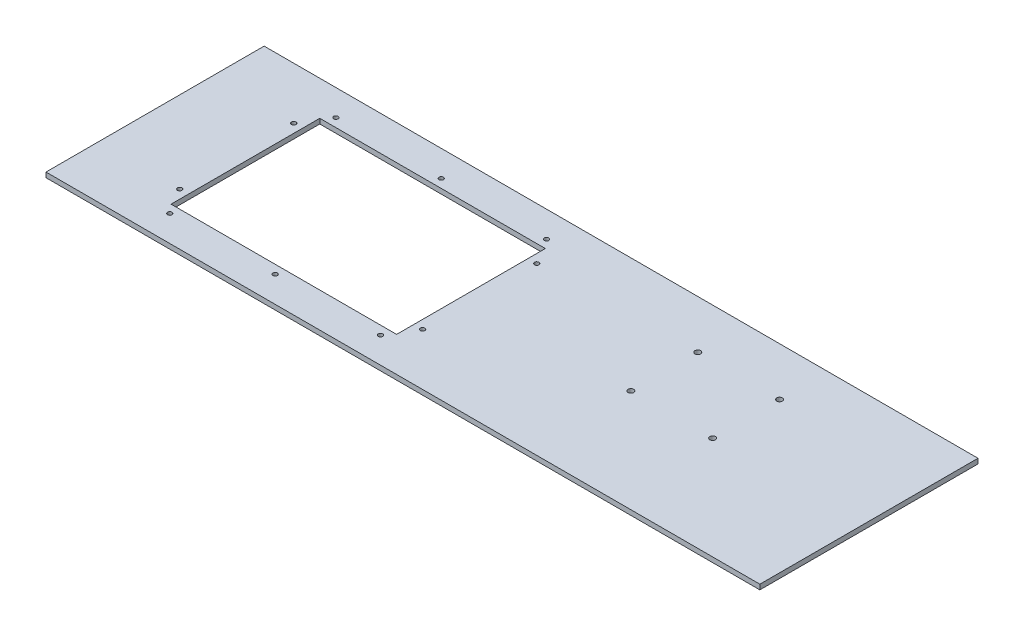
from build123d import *

# Parameters (mm, degrees)
IZIM1_W               = 1440
IZIM1_H               = 440
TABAN_FLAN_1_DEPTH    = 10
IZIM2_W               = 455
IZIM2_H               = 300
KES_EKSTR_ZYON1_DEPTH = 10
IZIM4_R               = 4.5
KES_EKSTR_ZYON4_DEPTH = 10
IZIM5_R               = 5.75
KES_EKSTR_ZYON5_DEPTH = 10


# Sheet-metal steps are written as plain solids
with BuildPart() as part:
    # Çizim1 → Taban-Flanş1 (new body)
    with BuildSketch(Plane(origin=(0, 0, 0), x_dir=(1, 0, 0), z_dir=(0, 1, 0))):
        Rectangle(IZIM1_W, IZIM1_H)
    extrude(amount=-TABAN_FLAN_1_DEPTH)

    # Çizim2 → Kes-Ekstrüzyon1 (cut)
    with BuildSketch(Plane(origin=(0, -10, 0), x_dir=(-1, 0, 0), z_dir=(0, -1, 0))):
        with Locations((310.25, 0)):
            Rectangle(IZIM2_W, IZIM2_H)
    extrude(amount=-KES_EKSTR_ZYON1_DEPTH, mode=Mode.SUBTRACT)

    # Çizim4 → Kes-Ekstrüzyon4 (cut)
    with BuildSketch(Plane(origin=(0, -10, 0), x_dir=(-1, 0, 0), z_dir=(0, -1, 0))):
        with Locations(Location((555.25, -115, 0), (0, 0, 90))):
            Circle(IZIM4_R)
        with Locations(Location((522.75, -167.5, 0), (0, 0, 90))):
            Circle(IZIM4_R)
        with Locations(Location((310.25, -167.5, 0), (0, 0, 90))):
            Circle(IZIM4_R)
        with Locations(Location((97.75, -167.5, 0), (0, 0, 90))):
            Circle(IZIM4_R)
        with Locations(Location((65.25, -115, 0), (0, 0, 90))):
            Circle(IZIM4_R)
        with Locations(Location((65.25, 115, 0), (0, 0, 270))):
            Circle(IZIM4_R)
        with Locations(Location((97.75, 167.5, 0), (0, 0, 270))):
            Circle(IZIM4_R)
        with Locations(Location((310.25, 167.5, 0), (0, 0, 270))):
            Circle(IZIM4_R)
        with Locations(Location((522.75, 167.5, 0), (0, 0, 270))):
            Circle(IZIM4_R)
        with Locations(Location((555.25, 115, 0), (0, 0, 270))):
            Circle(IZIM4_R)
    extrude(amount=-KES_EKSTR_ZYON4_DEPTH, mode=Mode.SUBTRACT)

    # Çizim5 → Kes-Ekstrüzyon5 (cut)
    with BuildSketch(Plane(origin=(0, 0, 0), x_dir=(1, 0, 0), z_dir=(0, 1, 0))):
        with Locations(Location((252.25, -12.5, 0), (0, 0, 270))):
            Circle(IZIM5_R)
        with Locations(Location((252.25, 122.5, 0), (0, 0, 270))):
            Circle(IZIM5_R)
        with Locations(Location((417.25, 122.5, 0), (0, 0, 270))):
            Circle(IZIM5_R)
        with Locations(Location((417.25, -12.5, 0), (0, 0, 270))):
            Circle(IZIM5_R)
    extrude(amount=-KES_EKSTR_ZYON5_DEPTH, mode=Mode.SUBTRACT)


solid = part.part
